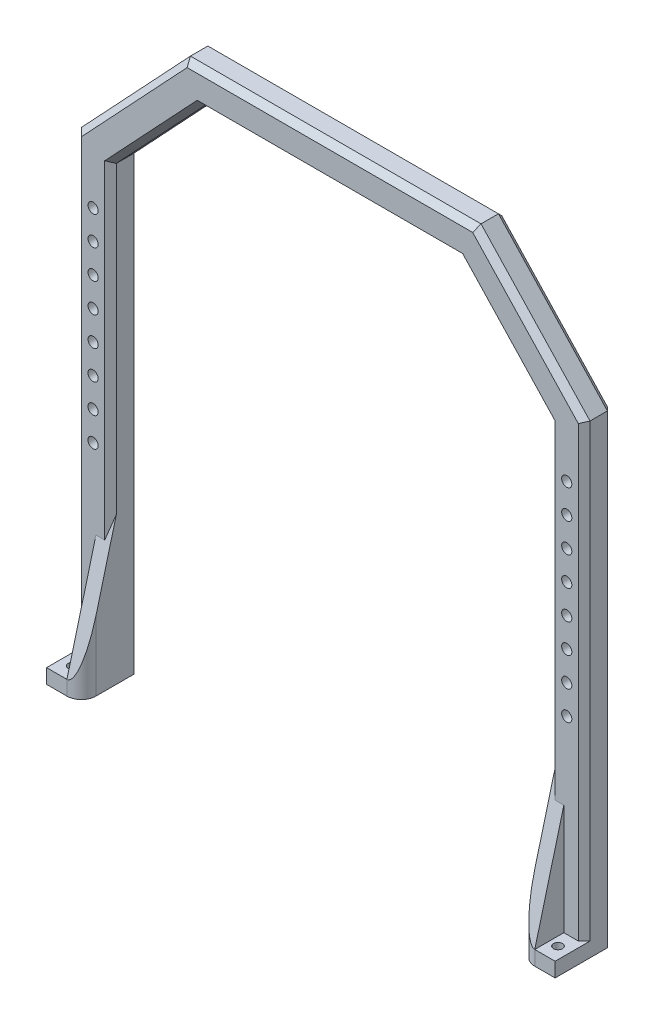
from build123d import *

# Parameters (mm, degrees)
BOSS_EXTRUDE1_DEPTH      = 5
BOSS_EXTRUDE1_DEPTH_BACK = 5
BOSS_EXTRUDE2_DEPTH      = 10
CUT_EXTRUDE1_DEPTH       = 262.627597933
SKETCH4_R                = 1.553741305
CUT_EXTRUDE2_DEPTH       = 215.257438611
CHAMFER1_SIZE            = 2
CHAMFER2_SIZE            = 2
FILLET1_R                = 5
SKETCH5_R                = 1.75
CUT_EXTRUDE3_DEPTH       = 220.217357889
LPATTERN1_COUNT          = 8
LPATTERN1_PITCH          = 10


with BuildPart() as part:
    # Sketch1 → Boss-Extrude1 (new, two sides: drawn at the far end of the back side and taken through both)
    with BuildSketch(Plane.XY.offset(-BOSS_EXTRUDE1_DEPTH_BACK)):
        Polygon((-87.5, -200), (-87.5, -40), (-50, 0), (50, 0), (87.5, -40), (87.5, -200), (75.5, -200), (75.5, -44.74536976), (44.80121585, -12), (-44.80121585, -12), (-75.5, -44.74536976), (-75.5, -200), align=None)
    extrude(amount=BOSS_EXTRUDE1_DEPTH + BOSS_EXTRUDE1_DEPTH_BACK)

    # Sketch2 → Boss-Extrude2 (add)
    with BuildSketch(Plane.XY.offset(5)):
        Polygon((-87.5, -200), (-75.5, -200), (-75.5, -197), (-75.5, -157), (-80.5, -157), (-80.5, -195), (-87.5, -195), align=None)
    boss_extrude2 = extrude(amount=BOSS_EXTRUDE2_DEPTH)

    # Sketch3 → Cut-Extrude1 (cut, through all)
    with BuildSketch(Plane.ZY.offset(80.5)):
        Polygon((5, -157), (15, -195), (15, -157), align=None)
    cut_extrude1 = extrude(amount=-CUT_EXTRUDE1_DEPTH, mode=Mode.SUBTRACT)

    # Sketch4 → Cut-Extrude2 (cut, through all)
    with BuildSketch(Plane(origin=(0, -195, 0), x_dir=(1, 0, 0), z_dir=(0, 1, 0))):
        with Locations((-83.5, -10)):
            Circle(SKETCH4_R)
    cut_extrude2 = extrude(amount=-CUT_EXTRUDE2_DEPTH, mode=Mode.SUBTRACT)

    # Mirror1: Boss-Extrude2, Cut-Extrude1, Cut-Extrude2 across plane
    add(boss_extrude2.mirror(Plane(origin=(0, 0, 0), x_dir=(0, 0, 1), z_dir=(1, 0, 0))))
    add(cut_extrude1.mirror(Plane(origin=(0, 0, 0), x_dir=(0, 0, 1), z_dir=(1, 0, 0))), mode=Mode.SUBTRACT)
    add(cut_extrude2.mirror(Plane(origin=(0, 0, 0), x_dir=(0, 0, 1), z_dir=(1, 0, 0))), mode=Mode.SUBTRACT)

    # Chamfer1
    chamfer1_edges = [part.edges().sort_by_distance(p)[0] for p in [
        (-75.5, -122.37268488, -5),
        (-60.150607925, -28.37268488, -5),
        (0, -12, -5),
        (60.150607925, -28.37268488, -5),
        (75.5, -122.37268488, -5),
        (81.5, -200, -5),
        (87.5, -120, -5),
        (68.75, -20, -5),
        (0, 0, -5),
        (-68.75, -20, -5),
        (-87.5, -120, -5),
        (-81.5, -200, -5),
    ]]
    chamfer(chamfer1_edges, length=CHAMFER1_SIZE)

    # Chamfer2
    chamfer2_edges = [part.edges().sort_by_distance(p)[0] for p in [
        (75.5, -100.87268488, 5),
        (60.150607925, -28.37268488, 5),
        (0, -12, 5),
        (-75.5, -100.87268488, 5),
        (-60.150607925, -28.37268488, 5),
        (87.5, -117.5, 5),
        (68.75, -20, 5),
        (0, 0, 5),
        (-68.75, -20, 5),
        (-87.5, -117.5, 5),
    ]]
    chamfer(chamfer2_edges, length=CHAMFER2_SIZE)

    # Fillet1
    fillet1_edges = [part.edges().sort_by_distance(p)[0] for p in [
        (75.5, -197.5, 15),
        (-75.5, -197.5, 15),
    ]]
    fillet(fillet1_edges, radius=FILLET1_R)

    # Sketch5 → Cut-Extrude3 (cut, through all)
    with BuildSketch(Plane(origin=(0, 0, -5), x_dir=(-1, 0, 0), z_dir=(0, 0, -1))):
        with Locations((-81.5, -130)):
            Circle(SKETCH5_R)
        with Locations((81.5, -130)):
            Circle(SKETCH5_R)
    cut_extrude3 = extrude(amount=-CUT_EXTRUDE3_DEPTH, mode=Mode.SUBTRACT)

    # LPattern1: Cut-Extrude3 ×8
    with Locations(*[(0, i * LPATTERN1_PITCH, 0) for i in range(1, LPATTERN1_COUNT)]):
        add(cut_extrude3, mode=Mode.SUBTRACT)


solid = part.part
